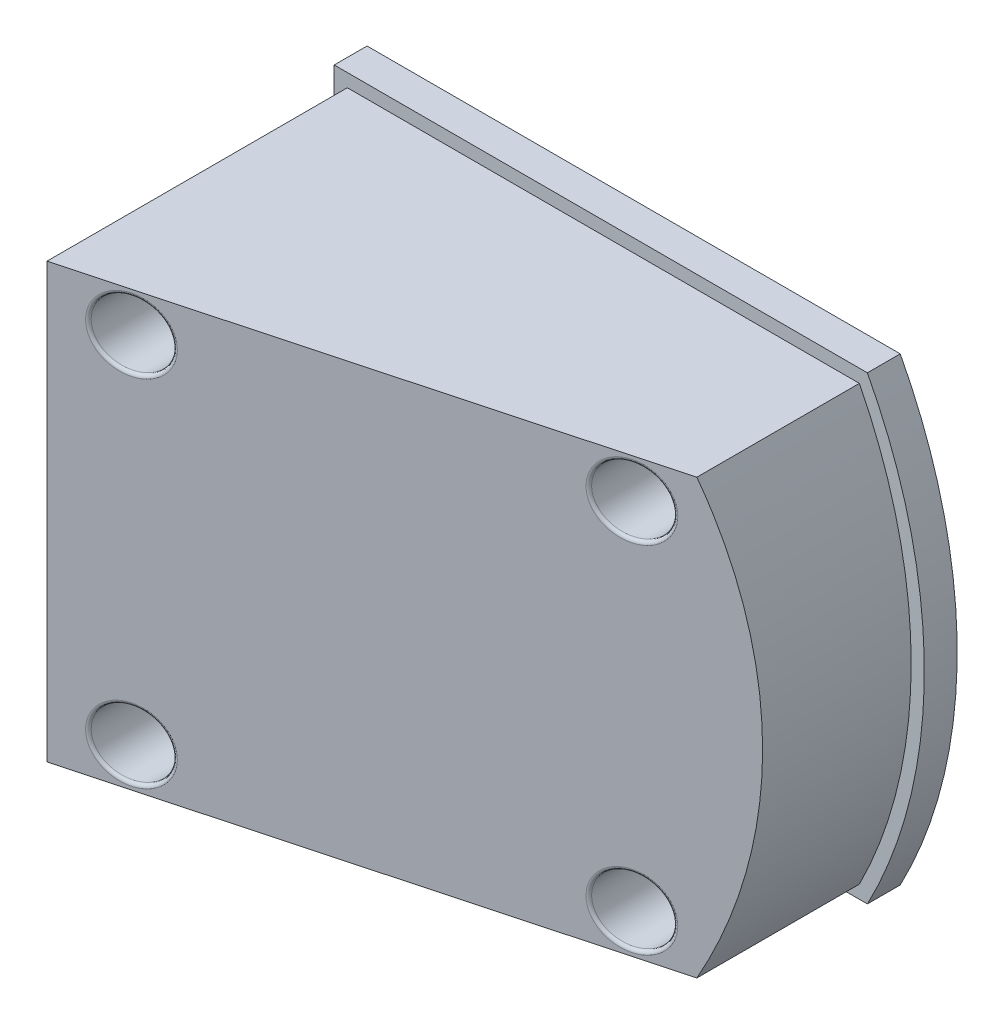
from build123d import *

# Parameters (mm, degrees)
BOSS_EXTRUDE1_DEPTH = 5
BOSS_EXTRUDE2_REACH = 84.916
CUT_EXTRUDE1_START  = -37
SKETCH3_R           = 5
CUT_EXTRUDE1_DEPTH  = 61.063642814
CUT_EXTRUDE2_START  = -22
SKETCH3_2_R         = 5
CUT_EXTRUDE2_DEPTH  = 76.063642814
SKETCH4_R           = 3
CUT_EXTRUDE3_DEPTH  = 98.063642814
FILLET1_R           = 0.5


with BuildPart() as part:
    # Sketch1 → Boss-Extrude1 (new body)
    with BuildSketch(Plane.XY):
        with BuildLine():
            Line((-14.801857106, 35), (-14.801857106, -35))
            Line((-14.801857106, -35), (66.332495807, -35))
            ThreePointArc((66.332495807, -35), (75, 0), (66.332495807, 35))
            Line((66.332495807, 35), (-14.801857106, 35))
        make_face()
    extrude(amount=BOSS_EXTRUDE1_DEPTH)

    # Boss-Extrude2: up to this plane
    boss_extrude2_end = Plane(origin=(43.999141518, -40, 35.415911681), z_dir=(0.2599734699102036, 0, 0.9656157594731191))
    # Sketch2 → Boss-Extrude2 (add, up to the surface)
    with BuildSketch(Plane.XY.offset(5), mode=Mode.PRIVATE) as boss_extrude2_sk1:
        with BuildLine():
            Line((65.115282384, 33), (-12.801857106, 33))
            Line((-12.801857106, 33), (-12.801857106, -33))
            Line((-12.801857106, -33), (65.115282384, -33))
            ThreePointArc((65.115282384, -33), (73, 0), (65.115282384, 33))
        make_face()
    boss_extrude2_tool1 = split(extrude(boss_extrude2_sk1.sketch, amount=BOSS_EXTRUDE2_REACH, mode=Mode.PRIVATE), bisect_by=boss_extrude2_end, keep=Keep.BOTH, mode=Mode.PRIVATE)
    add(boss_extrude2_tool1.solids().sort_by_distance((28.847354, 0, 5))[0])

    # Sketch3 → Cut-Extrude1 (cut, through all)
    with BuildSketch(Plane(origin=(0, 0, 0), x_dir=(-1, 0, 0), z_dir=(0, 0, -1)).offset(CUT_EXTRUDE1_START)):
        with Locations((2.801857106, 27)):
            Circle(SKETCH3_R)
        with Locations((-57.198142894, 27)):
            Circle(SKETCH3_R)
        with Locations((-57.198142894, -27)):
            Circle(SKETCH3_R)
        with Locations(Location((2.801857106, -27, 0), (0, 0, 180))):
            Circle(SKETCH3_R)
    extrude(amount=-CUT_EXTRUDE1_DEPTH, mode=Mode.SUBTRACT)

    # Sketch3<2> → Cut-Extrude2 (cut, through all)
    with BuildSketch(Plane(origin=(0, 0, 0), x_dir=(-1, 0, 0), z_dir=(0, 0, -1)).offset(CUT_EXTRUDE2_START)):
        with Locations((-57.198142894, 27)):
            Circle(SKETCH3_2_R)
        with Locations(Location((-57.198142894, -27, 0), (0, 0, 180))):
            Circle(SKETCH3_2_R)
    extrude(amount=-CUT_EXTRUDE2_DEPTH, mode=Mode.SUBTRACT)

    # Sketch4 → Cut-Extrude3 (cut, through all)
    with BuildSketch(Plane(origin=(0, 0, 0), x_dir=(-1, 0, 0), z_dir=(0, 0, -1))):
        with Locations((-57.198142894, 27)):
            Circle(SKETCH4_R)
        with Locations((2.801857106, 27)):
            Circle(SKETCH4_R)
        with Locations((2.801857106, -27)):
            Circle(SKETCH4_R)
        with Locations((-57.198142894, -27)):
            Circle(SKETCH4_R)
    extrude(amount=-CUT_EXTRUDE3_DEPTH, mode=Mode.SUBTRACT)

    # Fillet1
    fillet1_edges = [part.edges().sort_by_distance(p)[0] for p in [
        (-7.801857106, -27.000003438, 49.362334184),
        (2.198142894, 27.000003438, 46.670026531),
        (62.198142894, 27.000003438, 30.516180613),
        (62.198142894, 27, 22),
        (52.198142894, -27.000003438, 33.208488266),
    ]]
    fillet(fillet1_edges, radius=FILLET1_R)


solid = part.part
